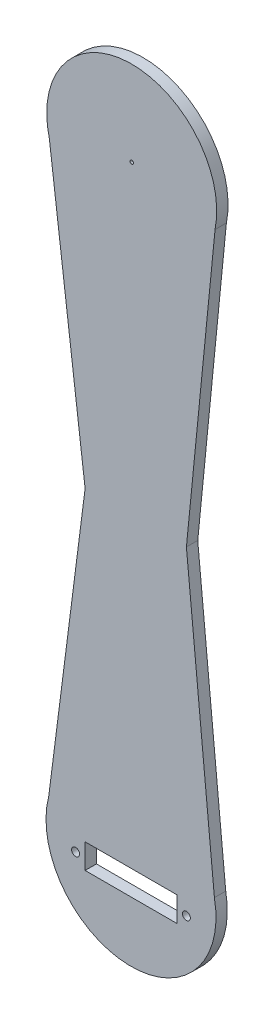
from build123d import *

# Parameters (mm, degrees)
SKETCH2_R            = 37.5
SKETCH2_R_2          = 1.75
SKETCH2_W            = 40.5
SKETCH2_H            = 21.9
SKETCH2_R_3          = 2.45
BOSS_EXTRUDE14_DEPTH = 5
SKETCH8_R            = 2.6
CUT_EXTRUDE7_DEPTH   = 310.857779009
SKETCH9_R            = 2.9
BOSS_EXTRUDE16_DEPTH = 1
SKETCH10_R           = 0.75
CUT_EXTRUDE8_DEPTH   = 310.843255877


with BuildPart() as part:
    # Sketch2 → Boss-Extrude14 (new body)
    # profile 1 of 5: a face of its own
    with BuildSketch(Plane.XY):
        Circle(SKETCH2_R)
        with Locations((24.45, -5.95)):
            Circle(SKETCH2_R_2, mode=Mode.SUBTRACT)
        with Locations((-24.45, -5.95)):
            Circle(SKETCH2_R_2, mode=Mode.SUBTRACT)
        Rectangle(SKETCH2_W, SKETCH2_H, mode=Mode.SUBTRACT)
    # profile 2 of 5: a face of its own
    with BuildSketch(Plane.XY):
        with Locations((24.45, 5.95)):
            Circle(SKETCH2_R_2)
    # profile 3 of 5: a face of its own
    with BuildSketch(Plane.XY):
        with Locations((-24.45, 5.95)):
            Circle(SKETCH2_R_2)
    # profile 4 of 5: a face of its own
    with BuildSketch(Plane.XY):
        with Locations((0.323183532, 270)):
            Circle(SKETCH2_R)
        with Locations((0.323183532, 270)):
            Circle(SKETCH2_R_3, mode=Mode.SUBTRACT)
    # profile 5 of 5: a face of its own
    with BuildSketch(Plane.XY):
        Polygon((-37.176816468, 270), (-20.25, 135), (-37.5, 0), (37.5, 0), (24.45, 135), (37.823183532, 270), align=None)
    extrude(amount=BOSS_EXTRUDE14_DEPTH)

    # Sketch8 → Cut-Extrude7 (cut, through all)
    with BuildSketch(Plane.XY.offset(5)):
        with Locations((0.323183532, 270)):
            Circle(SKETCH8_R)
    extrude(amount=-CUT_EXTRUDE7_DEPTH, mode=Mode.SUBTRACT)

    # Sketch9 → Boss-Extrude16 (add)
    with BuildSketch(Plane.XY.offset(5)):
        with Locations((0.323183532, 270)):
            Circle(SKETCH9_R)
    extrude(amount=-BOSS_EXTRUDE16_DEPTH)

    # Sketch10 → Cut-Extrude8 (cut, through all)
    with BuildSketch(Plane(origin=(0, 0, 4), x_dir=(-1, 0, 0), z_dir=(0, 0, -1))):
        with Locations((-0.323183532, 270)):
            Circle(SKETCH10_R)
    extrude(amount=-CUT_EXTRUDE8_DEPTH, mode=Mode.SUBTRACT)


solid = part.part
